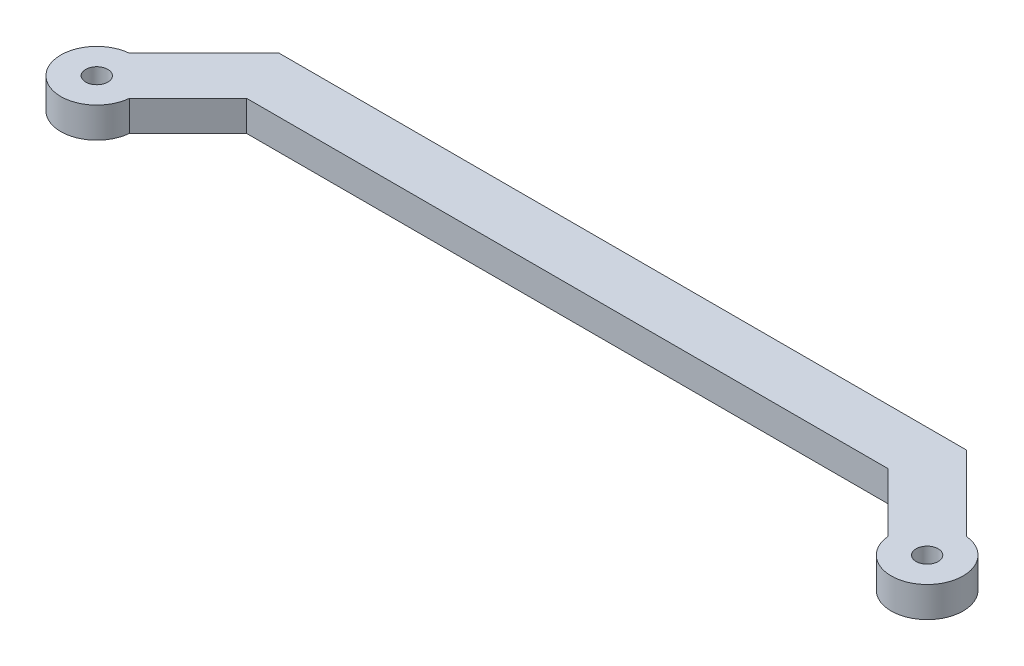
from build123d import *

# Parameters (mm, degrees)
SKETCH1_R           = 2
BOSS_EXTRUDE1_DEPTH = 5.5


with BuildPart() as part:
    # Sketch1 → Boss-Extrude1 (new body)
    with BuildSketch(Plane(origin=(0, 0, 0), x_dir=(1, 0, 0), z_dir=(0, 1, 0))):
        with BuildLine():
            Line((-57.928932188, 0), (57.928932188, 0))
            Line((57.928932188, 0), (68.527631063, -10.598698875))
            ThreePointArc((68.527631063, -10.598698875), (79.596194078, -14.596194078), (75.598698875, -3.527631063))
            Line((75.598698875, -3.527631063), (62.071067812, 10))
            Line((62.071067812, 10), (-62.071067812, 10))
            Line((-62.071067812, 10), (-75.598698875, -3.527631063))
            ThreePointArc((-75.598698875, -3.527631063), (-79.596194078, -14.596194078), (-68.527631063, -10.598698875))
            Line((-68.527631063, -10.598698875), (-57.928932188, 0))
        make_face()
        with Locations((75, -10)):
            Circle(SKETCH1_R, mode=Mode.SUBTRACT)
        with Locations((-75, -10)):
            Circle(SKETCH1_R, mode=Mode.SUBTRACT)
    extrude(amount=BOSS_EXTRUDE1_DEPTH)


solid = part.part
